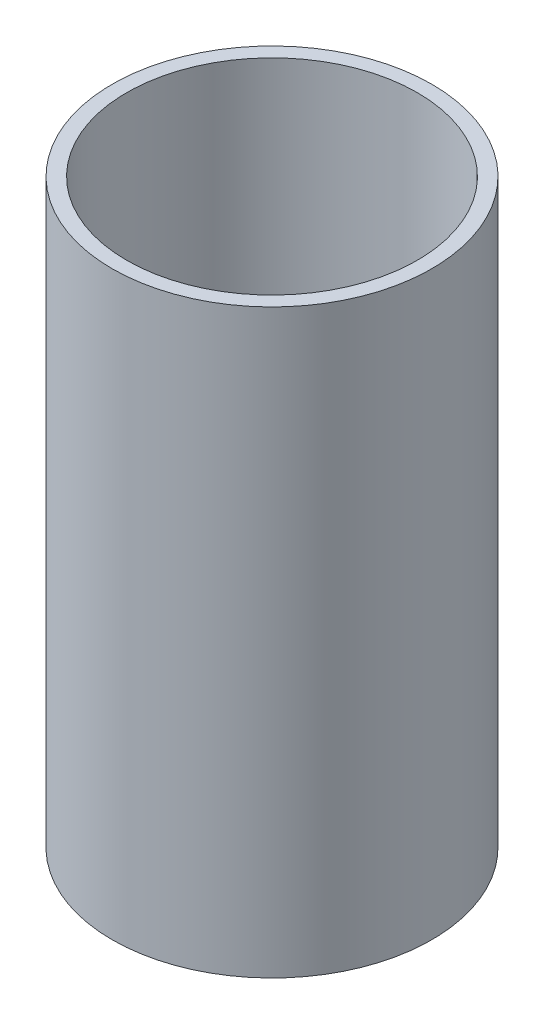
from build123d import *

# Parameters (mm, degrees)
SKETCH1_R      = 27.94
SKETCH1_R_2    = 25.4
EXTRUDE1_DEPTH = 101.6


with BuildPart() as part:
    # Sketch1 → Extrude1 (new body)
    with BuildSketch(Plane(origin=(0, 0, 0), x_dir=(1, 0, 0), z_dir=(0, 1, 0))):
        Circle(SKETCH1_R)
        Circle(SKETCH1_R_2, mode=Mode.SUBTRACT)
    extrude(amount=EXTRUDE1_DEPTH)


solid = part.part
